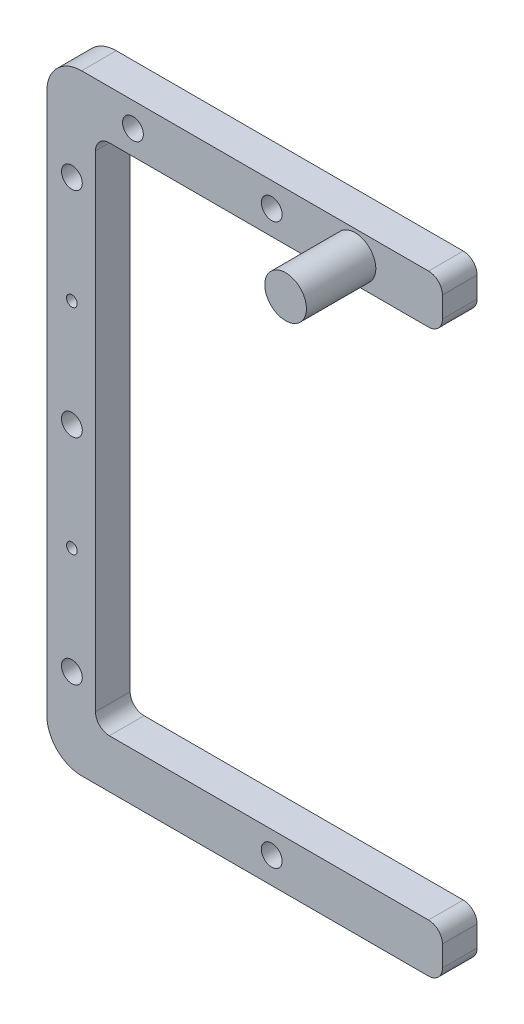
from build123d import *

# Parameters (mm, degrees)
BOSS_EXTRUDE1_DEPTH = 5
SKETCH3_R           = 3
BOSS_EXTRUDE2_DEPTH = 10
SKETCH5_R           = 1.5
CUT_EXTRUDE1_DEPTH  = 68.349832962
SKETCH6_R           = 0.77
CUT_EXTRUDE2_DEPTH  = 3


with BuildPart() as part:
    # Sketch2 → Boss-Extrude1 (new body)
    with BuildSketch(Plane.XY):
        with BuildLine():
            Line((0, -35), (0, 35))
            ThreePointArc((0, 35), (0.585786438, 36.414213562), (2, 37))
            Line((2, 37), (48, 37))
            ThreePointArc((48, 37), (49.414213562, 37.585786438), (50, 39))
            Line((50, 39), (50, 42))
            ThreePointArc((50, 42), (49.414213562, 43.414213562), (48, 44))
            Line((48, 44), (-2, 44))
            ThreePointArc((-2, 44), (-5.535533906, 42.535533906), (-7, 39))
            Line((-7, 39), (-7, -39))
            ThreePointArc((-7, -39), (-5.535533906, -42.535533906), (-2, -44))
            Line((-2, -44), (48, -44))
            ThreePointArc((48, -44), (49.414213562, -43.414213562), (50, -42))
            Line((50, -42), (50, -39))
            ThreePointArc((50, -39), (49.414213562, -37.585786438), (48, -37))
            Line((48, -37), (2, -37))
            ThreePointArc((2, -37), (0.585786438, -36.414213562), (0, -35))
        make_face()
    extrude(amount=BOSS_EXTRUDE1_DEPTH)

    # Sketch3 → Boss-Extrude2 (add)
    with BuildSketch(Plane.XY.offset(5)):
        with Locations((37.4, 40.5)):
            Circle(SKETCH3_R)
    extrude(amount=BOSS_EXTRUDE2_DEPTH)

    # Sketch5 → Cut-Extrude1 (cut, through all)
    with BuildSketch(Plane.XY.offset(5)):
        with Locations((25.4, 40.5)):
            Circle(SKETCH5_R)
        with Locations((5.4, 40.5)):
            Circle(SKETCH5_R)
        with Locations((-3.4, 30)):
            Circle(SKETCH5_R)
        with Locations((-3.4, -0.85)):
            Circle(SKETCH5_R)
        with Locations((-3.4, -31.7)):
            Circle(SKETCH5_R)
        with Locations((25.4, -40.2)):
            Circle(SKETCH5_R)
    extrude(amount=-CUT_EXTRUDE1_DEPTH, mode=Mode.SUBTRACT)

    # Sketch6 → Cut-Extrude2 (cut)
    with BuildSketch(Plane.XY.offset(5)):
        with Locations((-3.4, 14.575)):
            Circle(SKETCH6_R)
        with Locations((-3.4, -16.275)):
            Circle(SKETCH6_R)
    extrude(amount=-CUT_EXTRUDE2_DEPTH, mode=Mode.SUBTRACT)


solid = part.part
